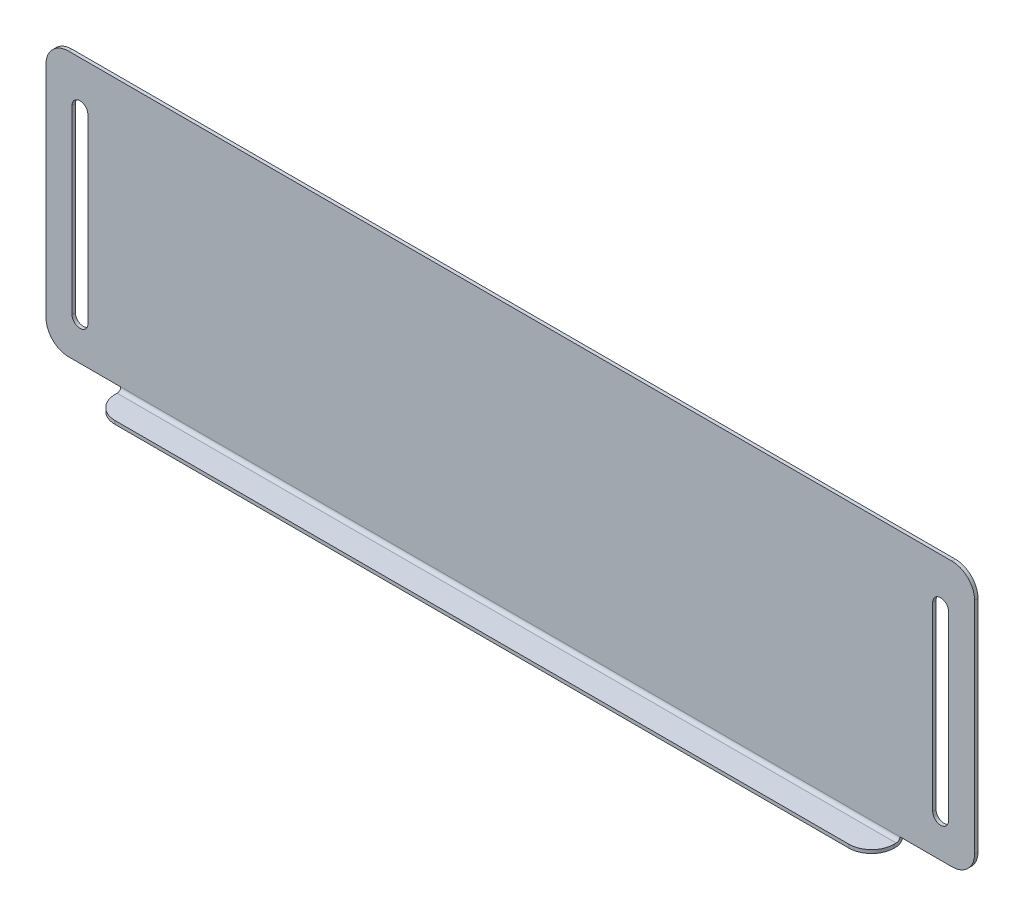
from build123d import *

# Parameters (mm, degrees)
SKETCH_1_W                       = 410
SKETCH_1_H                       = 120
SM_BASE_FLANGE_1_DEPTH           = 1.5
SM_EDGE_FLANGE_1_STRIP_W         = 9.2
SM_EDGE_FLANGE_1_STRIP_H         = 1.5
SM_EDGE_FLANGE_1_STRIP_CUT_DEPTH = 410
SM_EDGE_FLANGE_1_DEPTH           = 410
SKETCH_8_W                       = 33
SKETCH_8_H                       = 14
CUT_EXTRUDE_1_DEPTH              = 3.1
FILLET_2_R                       = 10
CUT_EXTRUDE_3_DEPTH              = 10


# Sheet-metal steps are written as plain solids
with BuildPart() as part:
    # Sketch 1 → Базовая кромка1 (new body)
    with BuildSketch(Plane.XY):
        Rectangle(SKETCH_1_W, SKETCH_1_H)
    extrude(amount=-SM_BASE_FLANGE_1_DEPTH)

    # Ребро-кромка1 strip (across the edge) → Ребро-кромка1 strip cut (cut)
    with BuildSketch(Plane(origin=(-205, -60, 0), x_dir=(0, 1, 0), z_dir=(1, 0, 0))):
        with Locations((-1.5, -0.75)):
            Rectangle(SM_EDGE_FLANGE_1_STRIP_W, SM_EDGE_FLANGE_1_STRIP_H)
    extrude(amount=SM_EDGE_FLANGE_1_STRIP_CUT_DEPTH, mode=Mode.SUBTRACT)

    # Ребро-кромка1 section (across the edge) → Ребро-кромка1 (add)
    with BuildSketch(Plane(origin=(-205, -60, 0), x_dir=(0, 1, 0), z_dir=(1, 0, 0))):
        with BuildLine():
            Line((0, 1.6), (0, 12.5))
            Line((0, 12.5), (1.5, 12.5))
            Line((1.5, 12.5), (1.5, 1.6))
            ThreePointArc((1.5, 1.6), (1.96862915, 0.46862915), (3.1, 0))
            Line((3.1, 0), (3.1, -1.5))
            ThreePointArc((3.1, -1.5), (0.907968978, -0.592031022), (0, 1.6))
        make_face()
    extrude(amount=SM_EDGE_FLANGE_1_DEPTH)

    # Эскиз8 → Вырез-Вытянуть1 (cut)
    with BuildSketch(Plane(origin=(0, -60, 0), x_dir=(1, 0, 0), z_dir=(0, 1, 0))):
        with Locations((-188.5, -5.5)):
            Rectangle(SKETCH_8_W, SKETCH_8_H)
        with Locations((188.5, -5.5)):
            Rectangle(SKETCH_8_W, SKETCH_8_H)
    extrude(amount=CUT_EXTRUDE_1_DEPTH, mode=Mode.SUBTRACT)

    # Скругление2
    fillet_2_edges = [part.edges().sort_by_distance(p)[0] for p in [
        (-205, -56.9, -0.75),
        (205, -56.9, -0.75),
        (-172, -59.25, 12.5),
        (-205, 60, -0.75),
        (205, 60, -0.75),
        (172, -59.25, 12.5),
    ]]
    fillet(fillet_2_edges, radius=FILLET_2_R)

    # Эскиз13 → Вырез-Вытянуть3 (cut)
    with BuildSketch(Plane.XY):
        with BuildLine():
            Line((-186.5, 40), (-186.5, -40))
            ThreePointArc((-186.5, -40), (-190, -43.5), (-193.5, -40))
            Line((-193.5, -40), (-193.5, 40))
            ThreePointArc((-193.5, 40), (-190, 43.5), (-186.5, 40))
        make_face()
        with BuildLine():
            Line((186.5, 40), (186.5, -40))
            ThreePointArc((186.5, -40), (190, -43.5), (193.5, -40))
            Line((193.5, -40), (193.5, 40))
            ThreePointArc((193.5, 40), (190, 43.5), (186.5, 40))
        make_face()
    extrude(amount=-CUT_EXTRUDE_3_DEPTH, mode=Mode.SUBTRACT)


solid = part.part
